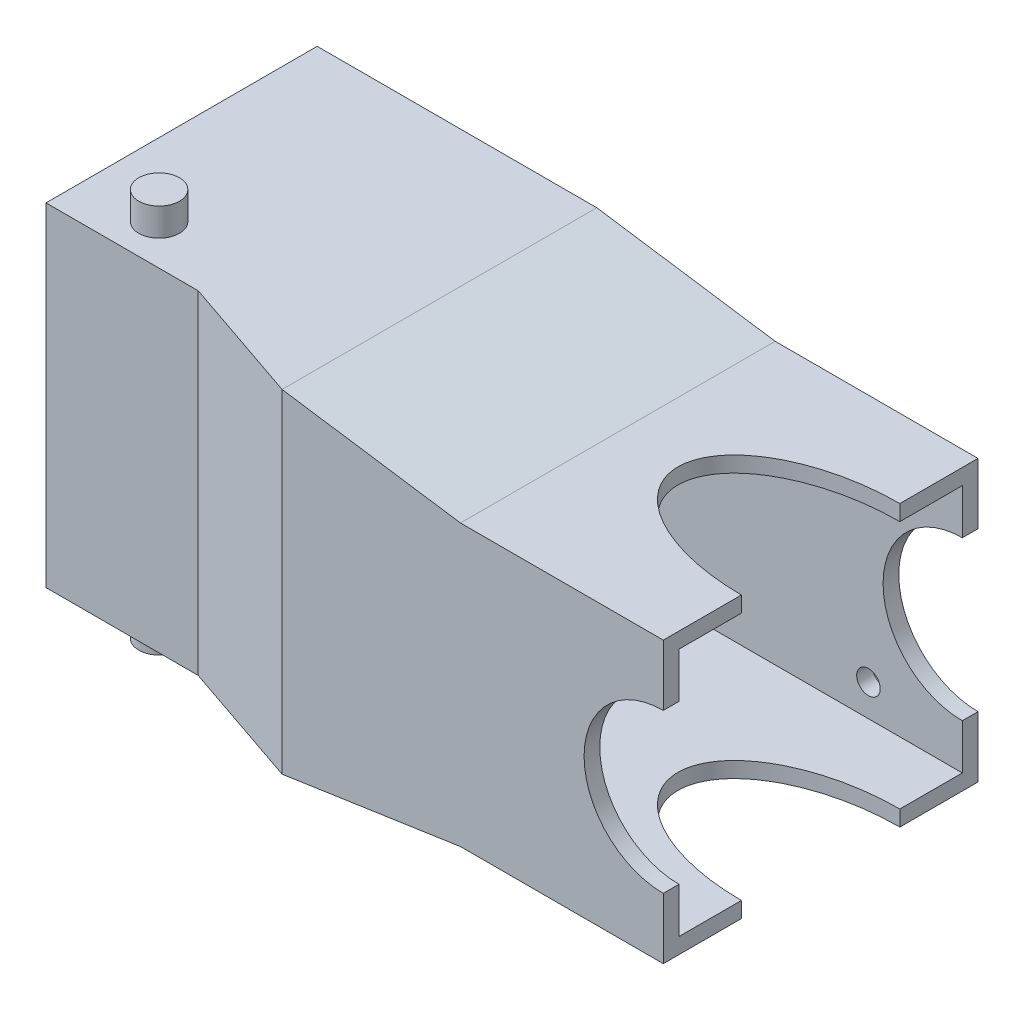
from build123d import *

# Parameters (mm, degrees)
ESQUISSE1_W             = 44.1
ESQUISSE1_H             = 39.27
BOSS_EXTRU_1_DEPTH      = 28.42
ESQUISSE2_W             = 39.7
ESQUISSE2_H             = 34.87
ENL_V_MAT_EXTRU_1_DEPTH = 28.42
ESQUISSE3_R             = 11.1
ENL_V_MAT_EXTRU_2_DEPTH = 50
ESQUISSE4_RX            = 20
ESQUISSE4_RY            = 11.1
ENL_V_MAT_EXTRU_3_DEPTH = 50
ESQUISSE5_R             = 1.65
ENL_V_MAT_EXTRU_4_DEPTH = 10
ESQUISSE6_W             = 64.18
ESQUISSE6_H             = 39.27
BOSS_EXTRU_2_DEPTH      = 2.2
ESQUISSE8_W             = 44.1
ESQUISSE8_H             = 39.27
BOSS_EXTRU_3_DEPTH      = 25
BOSS_EXTRU_4_DEPTH      = 44.1
BOSS_EXTRU_5_START      = -2.2
ESQUISSE13_W            = 39.18
ESQUISSE13_H            = 3.71
BOSS_EXTRU_5_DEPTH      = 2.2
ESQUISSE14_W            = 39.7
ESQUISSE14_H            = 34.87
ENL_V_MAT_EXTRU_5_DEPTH = 25
ESQUISSE17_W            = 38
ESQUISSE17_H            = 46.69
BOSS_EXTRU_6_DEPTH      = 39.18
ESQUISSE18_W            = 35.2475242
ESQUISSE18_H            = 42.29
ENL_V_MAT_EXTRU_6_DEPTH = 50
BOSS_EXTRU_7_DEPTH      = 46.69
CONG_1_R                = 50
ESQUISSE23_R            = 2.85
BOSS_EXTRU_8_DEPTH      = 3.9
BOSS_EXTRU_9_START      = 3.9
ESQUISSE26_R            = 2.85
BOSS_EXTRU_9_DEPTH      = 3.9


with BuildPart() as part:
    # Esquisse1 → Boss.-Extru.1 (new body)
    with BuildSketch(Plane(origin=(0, 0, 0), x_dir=(0, 0, -1), z_dir=(1, 0, 0))):
        Rectangle(ESQUISSE1_W, ESQUISSE1_H)
    extrude(amount=BOSS_EXTRU_1_DEPTH)

    # Esquisse2 → Enlèv. mat.-Extru.1 (cut)
    with BuildSketch(Plane.ZY):
        Rectangle(ESQUISSE2_W, ESQUISSE2_H)
    extrude(amount=-ENL_V_MAT_EXTRU_1_DEPTH, mode=Mode.SUBTRACT)

    # Esquisse3 → Enlèv. mat.-Extru.2 (cut)
    with BuildSketch(Plane.XY.offset(22.05)):
        with Locations((28.42, 0)):
            Circle(ESQUISSE3_R)
    extrude(amount=-ENL_V_MAT_EXTRU_2_DEPTH, mode=Mode.SUBTRACT)

    # Esquisse4 → Enlèv. mat.-Extru.3 (cut)
    with BuildSketch(Plane.XZ.offset(19.635)):
        with Locations(Location((28.42, 0), (0, 0, -180))):
            Ellipse(ESQUISSE4_RX, ESQUISSE4_RY)
    extrude(amount=-ENL_V_MAT_EXTRU_3_DEPTH, mode=Mode.SUBTRACT)

    # Esquisse5 → Enlèv. mat.-Extru.4 (cut)
    with BuildSketch(Plane(origin=(0, 0, -22.05), x_dir=(-1, 0, 0), z_dir=(0, 0, -1))):
        with Locations((-15.27, -12.985)):
            Circle(ESQUISSE5_R)
        with Locations((-15.27, 12.985)):
            Circle(ESQUISSE5_R)
    extrude(amount=-ENL_V_MAT_EXTRU_4_DEPTH, mode=Mode.SUBTRACT)

    # Esquisse6 → Boss.-Extru.2 (add)
    with BuildSketch(Plane(origin=(0, 0, -22.05), x_dir=(-1, 0, 0), z_dir=(0, 0, -1))):
        with Locations((32.09, 0)):
            Rectangle(ESQUISSE6_W, ESQUISSE6_H)
    extrude(amount=-BOSS_EXTRU_2_DEPTH)

    # Esquisse8 → Boss.-Extru.3 (add)
    with BuildSketch(Plane.ZY):
        Rectangle(ESQUISSE8_W, ESQUISSE8_H)
    extrude(amount=BOSS_EXTRU_3_DEPTH)

    # Esquisse10 → Boss.-Extru.4 (add)
    with BuildSketch(Plane.XY.offset(22.05)):
        Polygon((-25, -19.635), (0, -19.635), (-25, -23.345), align=None)
        Polygon((-25, 19.635), (0, 19.635), (-25, 23.345), align=None)
    extrude(amount=-BOSS_EXTRU_4_DEPTH)

    # Esquisse13 → Boss.-Extru.5 (add)
    with BuildSketch(Plane(origin=(0, 0, -22.05), x_dir=(-1, 0, 0), z_dir=(0, 0, -1)).offset(BOSS_EXTRU_5_START)):
        with Locations((44.59, 21.49)):
            Rectangle(ESQUISSE13_W, ESQUISSE13_H)
        with Locations((44.59, -21.49)):
            Rectangle(ESQUISSE13_W, ESQUISSE13_H)
    extrude(amount=BOSS_EXTRU_5_DEPTH)

    # Esquisse14 → Enlèv. mat.-Extru.5 (cut)
    with BuildSketch(Plane(origin=(0, 0, 0), x_dir=(0, 0, -1), z_dir=(1, 0, 0))):
        Rectangle(ESQUISSE14_W, ESQUISSE14_H)
    extrude(amount=-ENL_V_MAT_EXTRU_5_DEPTH, mode=Mode.SUBTRACT)

    # Esquisse17 → Boss.-Extru.6 (add)
    with BuildSketch(Plane.ZY.offset(64.18)):
        with Locations((-3.05, 0)):
            Rectangle(ESQUISSE17_W, ESQUISSE17_H)
    extrude(amount=-BOSS_EXTRU_6_DEPTH)

    # Esquisse18 → Enlèv. mat.-Extru.6 (cut)
    with BuildSketch(Plane.ZY.offset(64.18)):
        with Locations((-3.8737621, 0)):
            Rectangle(ESQUISSE18_W, ESQUISSE18_H)
    extrude(amount=-ENL_V_MAT_EXTRU_6_DEPTH, mode=Mode.SUBTRACT)

    # Esquisse22 → Boss.-Extru.7 (add)
    with BuildSketch(Plane.XZ.offset(23.345)):
        Polygon((-42.845664821, 15.95), (-25, 15.95), (-25, 22.05), align=None)
    extrude(amount=-BOSS_EXTRU_7_DEPTH)

    # Congé1
    # the kernel refuses this fillet: 50 mm, written as the material it takes off along each edge
    with BuildSketch(Plane(origin=(-25, 17.435, 13.75), x_dir=(0, 0, 1), z_dir=(0, -1, 0))) as cong_1_piece_1:
        with BuildLine():
            CenterArc((50, 23.933031567), CONG_1_R, 180, 28.597962222)
            Line((0, 23.933031567), (0, 0))
            Line((0, 0), (6.1, 0))
        make_face()
    extrude(amount=34.87, mode=Mode.SUBTRACT)

    # Esquisse23 → Boss.-Extru.8 (add)
    with BuildSketch(Plane(origin=(0, 23.345, 0), x_dir=(1, 0, 0), z_dir=(0, 1, 0))):
        with Locations(Location((-53.98, -10.3, 0), (0, 0, 180))):
            Circle(ESQUISSE23_R)
    extrude(amount=BOSS_EXTRU_8_DEPTH)

    # Esquisse26 → Boss.-Extru.9 (add)
    with BuildSketch(Plane.XZ.offset(23.345).offset(BOSS_EXTRU_9_START)):
        with Locations(Location((-53.98, 10.3, 0), (0, 0, 180))):
            Circle(ESQUISSE26_R)
    extrude(amount=-BOSS_EXTRU_9_DEPTH)


solid = part.part
